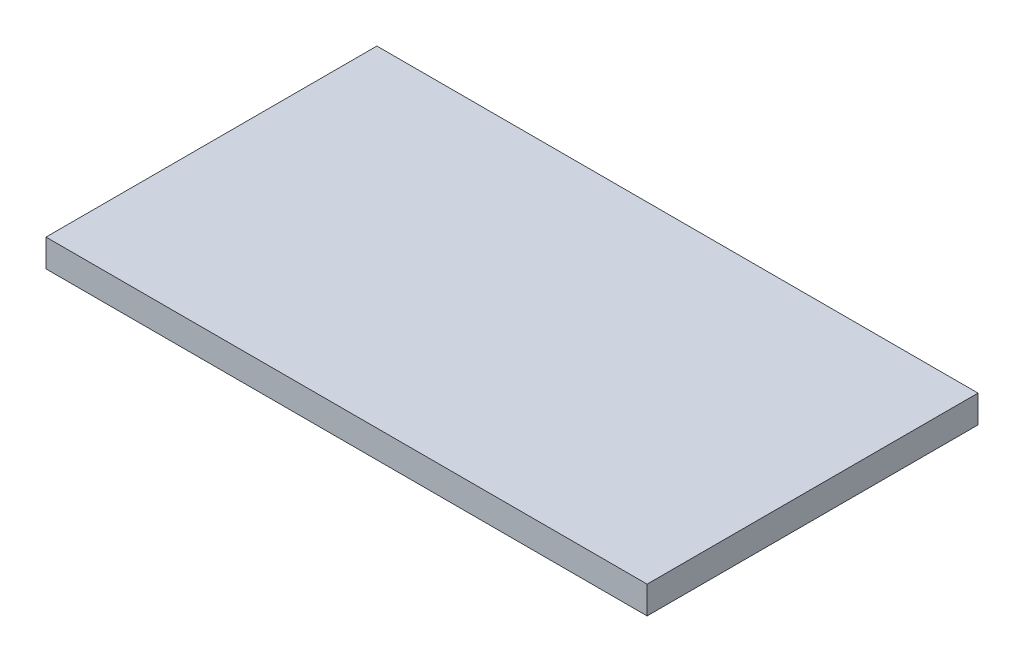
from build123d import *

# Parameters (mm, degrees)
SKETCH1_W           = 109
SKETCH1_H           = 60
BOSS_EXTRUDE1_DEPTH = 5


with BuildPart() as part:
    # Sketch1 → Boss-Extrude1 (new body)
    with BuildSketch(Plane(origin=(0, 0, 0), x_dir=(1, 0, 0), z_dir=(0, 1, 0))):
        Rectangle(SKETCH1_W, SKETCH1_H)
    extrude(amount=BOSS_EXTRUDE1_DEPTH)


solid = part.part
